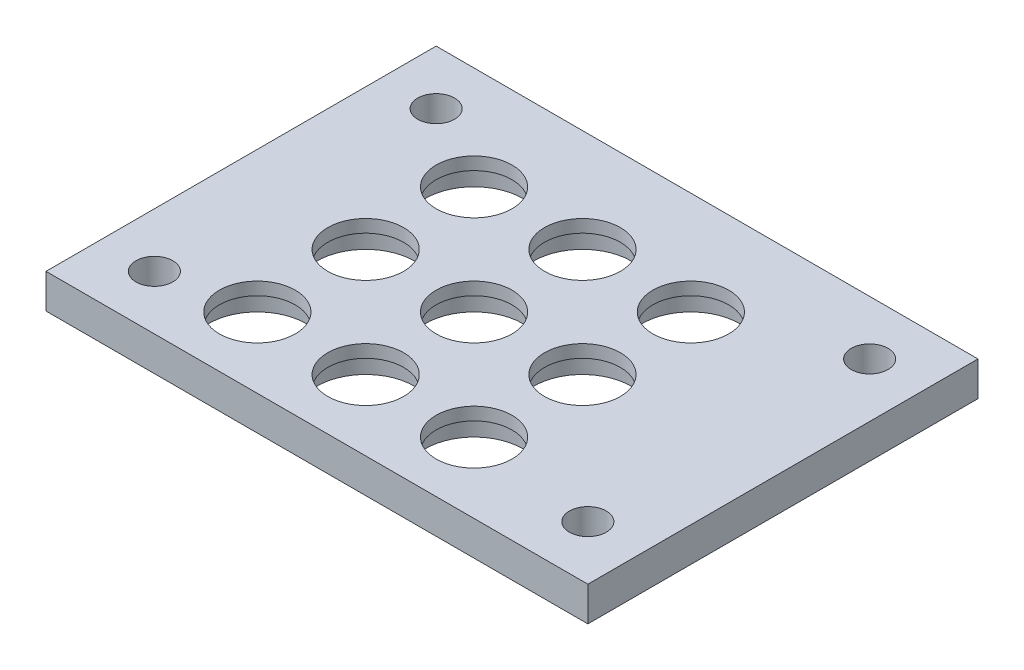
from build123d import *

# Parameters (mm, degrees)
SKETCH1_W           = 50
SKETCH1_H           = 36
SKETCH1_R           = 1.7
SKETCH1_R_2         = 3.5
BOSS_EXTRUDE1_DEPTH = 3.175
SKETCH2_R           = 4.5
CUT_EXTRUDE1_DEPTH  = 2


with BuildPart() as part:
    # Sketch1 → Boss-Extrude1 (new body)
    with BuildSketch(Plane(origin=(0, 0, 0), x_dir=(1, 0, 0), z_dir=(0, 1, 0))):
        with Locations((25, 18)):
            Rectangle(SKETCH1_W, SKETCH1_H)
        with Locations((5, 5)):
            Circle(SKETCH1_R, mode=Mode.SUBTRACT)
        with Locations((13, 6.5)):
            Circle(SKETCH1_R_2, mode=Mode.SUBTRACT)
        with Locations((23, 6.5)):
            Circle(SKETCH1_R_2, mode=Mode.SUBTRACT)
        with Locations((13, 16.5)):
            Circle(SKETCH1_R_2, mode=Mode.SUBTRACT)
        with Locations((23, 16.5)):
            Circle(SKETCH1_R_2, mode=Mode.SUBTRACT)
        with Locations((33, 6.5)):
            Circle(SKETCH1_R_2, mode=Mode.SUBTRACT)
        with Locations((45, 5)):
            Circle(SKETCH1_R, mode=Mode.SUBTRACT)
        with Locations((33, 16.5)):
            Circle(SKETCH1_R_2, mode=Mode.SUBTRACT)
        with Locations((13, 26.5)):
            Circle(SKETCH1_R_2, mode=Mode.SUBTRACT)
        with Locations((23, 26.5)):
            Circle(SKETCH1_R_2, mode=Mode.SUBTRACT)
        with Locations((5, 31)):
            Circle(SKETCH1_R, mode=Mode.SUBTRACT)
        with Locations((33, 26.5)):
            Circle(SKETCH1_R_2, mode=Mode.SUBTRACT)
        with Locations((45, 31)):
            Circle(SKETCH1_R, mode=Mode.SUBTRACT)
    extrude(amount=BOSS_EXTRUDE1_DEPTH)

    # Sketch2 → Cut-Extrude1 (cut)
    with BuildSketch(Plane.XZ):
        with Locations((13, -6.5)):
            Circle(SKETCH2_R)
        with Locations((23, -6.5)):
            Circle(SKETCH2_R)
        with Locations((33, -6.5)):
            Circle(SKETCH2_R)
        with Locations((23, -16.5)):
            Circle(SKETCH2_R)
        with Locations((33, -16.5)):
            Circle(SKETCH2_R)
        with Locations((23, -26.5)):
            Circle(SKETCH2_R)
        with Locations((33, -26.5)):
            Circle(SKETCH2_R)
        with Locations((13, -16.5)):
            Circle(SKETCH2_R)
        with Locations((13, -26.5)):
            Circle(SKETCH2_R)
    extrude(amount=-CUT_EXTRUDE1_DEPTH, mode=Mode.SUBTRACT)


solid = part.part
